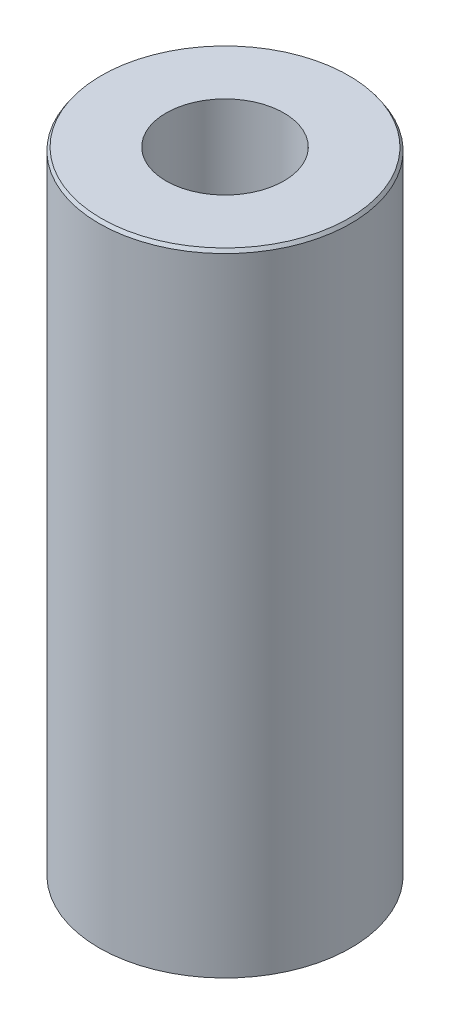
from build123d import *
from OCP.BRepFilletAPI import BRepFilletAPI_MakeChamfer

# Parameters (mm, degrees)
SKETCH1_R           = 47.5
BOSS_EXTRUDE1_DEPTH = 238.673050811
SKETCH2_R           = 22.222924384
CUT_EXTRUDE1_DEPTH  = 248.946214296
CHAMFER1_SIZE       = 1.242862677
CHAMFER1_SIZE2      = 0.832250777


with BuildPart() as part:
    # Sketch1 → Boss-Extrude1 (new body)
    with BuildSketch(Plane(origin=(0, 0, 0), x_dir=(1, 0, 0), z_dir=(0, 1, 0))):
        Circle(SKETCH1_R)
    extrude(amount=BOSS_EXTRUDE1_DEPTH)

    # Sketch2 → Cut-Extrude1 (cut, through all)
    with BuildSketch(Plane(origin=(0, 0, 0), x_dir=(1, 0, 0), z_dir=(0, 1, 0))):
        Circle(SKETCH2_R)
    extrude(amount=CUT_EXTRUDE1_DEPTH, mode=Mode.SUBTRACT)

    # Chamfer1: one chamfer whose edges measure the first distance from different faces: ONE call of the kernel's chamfer builder (chamfer() names one face for all edges)
    chamfer1_edges_1 = [part.edges().sort_by_distance(p)[0] for p in [
        (-47.5, 238.673050811, 0),
    ]]
    chamfer1_side_1 = [part.faces().sort_by_distance(p)[0] for p in [
        (-47.5, 119.336525406, 0),
    ]]
    chamfer1_edges_2 = [part.edges().sort_by_distance(p)[0] for p in [
        (-47.5, 0, 0),
    ]]
    chamfer1_side_2 = [part.faces().sort_by_distance(p)[0] for p in [
        (-46.156497116, 0, 0),
    ]]
    chamfer1 = BRepFilletAPI_MakeChamfer(part.part.solid().wrapped)
    for e in chamfer1_edges_1:
        chamfer1.Add(CHAMFER1_SIZE, CHAMFER1_SIZE2, e.wrapped, chamfer1_side_1[0].wrapped)  # the first distance lies on this face
    for e in chamfer1_edges_2:
        chamfer1.Add(CHAMFER1_SIZE, CHAMFER1_SIZE2, e.wrapped, chamfer1_side_2[0].wrapped)  # the first distance lies on this face
    add(Compound.cast(chamfer1.Shape()), mode=Mode.REPLACE)


solid = part.part
